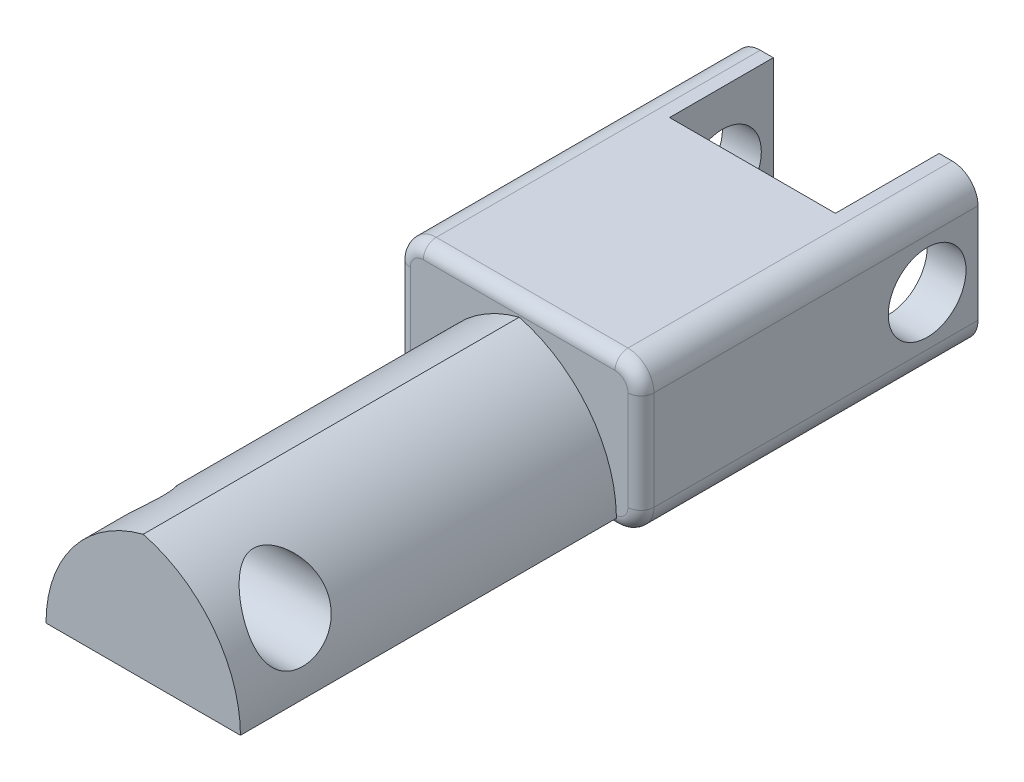
from build123d import *

# Parameters (mm, degrees)
SKETCH1_W                = 15
SKETCH1_H                = 10
BOSS_EXTRUDE1_DEPTH      = 40
BOSS_EXTRUDE2_DEPTH      = 15
BOSS_EXTRUDE2_DEPTH_BACK = 11
SKETCH3_W                = 18.791763322
SKETCH3_H                = 11.646727992
SKETCH4_W                = 12.791763322
SKETCH4_H                = 8
CUT_EXTRUDE1_DEPTH       = 43.707480201
SKETCH5_R                = 3
CUT_EXTRUDE2_DEPTH       = 44.810756502
CUT_EXTRUDE3_DEPTH       = 49.282441533
CUT_EXTRUDE3_DEPTH_BACK  = 49.282441533
SKETCH6_OUTSIDE_W        = 32.648
SKETCH6_OUTSIDE_H        = 25.502
FILLET1_R                = 10
FILLET2_R                = 1
SKETCH7_R                = 3
CUT_EXTRUDE4_DEPTH       = 45.576248719


with BuildPart() as part:
    # Sketch1 → Boss-Extrude1 (new body)
    with BuildSketch(Plane.XY):
        Rectangle(SKETCH1_W, SKETCH1_H)
    extrude(amount=BOSS_EXTRUDE1_DEPTH)

    # Sketch3 → Boss-Extrude2 (add, two sides: drawn at the far end of the back side and taken through both)
    with BuildSketch(Plane(origin=(0, 0, 0), x_dir=(-1, 0, 0), z_dir=(0, 0, -1)).offset(-BOSS_EXTRUDE2_DEPTH_BACK)):
        Rectangle(SKETCH3_W, SKETCH3_H)
    extrude(amount=BOSS_EXTRUDE2_DEPTH + BOSS_EXTRUDE2_DEPTH_BACK)

    # Sketch4 → Cut-Extrude1 (cut, through all)
    with BuildSketch(Plane(origin=(0, 5.823363996, 0), x_dir=(1, 0, 0), z_dir=(0, 1, 0))):
        with Locations((0, 11)):
            Rectangle(SKETCH4_W, SKETCH4_H)
    extrude(amount=-CUT_EXTRUDE1_DEPTH, mode=Mode.SUBTRACT)

    # Sketch5 → Cut-Extrude2 (cut, through all)
    with BuildSketch(Plane.ZY.offset(7.5)):
        with Locations(Location((35, 0, 0), (0, 0, 270))):
            Circle(SKETCH5_R)
    extrude(amount=-CUT_EXTRUDE2_DEPTH, mode=Mode.SUBTRACT)

    # Sketch6 outside → Cut-Extrude3 (cut, two sides: drawn at the far end of the back side and taken through both)
    with BuildSketch(Plane(origin=(0, 0, -7), x_dir=(-1, 0, 0), z_dir=(0, 0, -1)).offset(-CUT_EXTRUDE3_DEPTH_BACK)):
        Rectangle(SKETCH6_OUTSIDE_W, SKETCH6_OUTSIDE_H)
        with BuildLine():
            Line((-7.395881661, 5.823363996), (7.395881661, 5.823363996))
            ThreePointArc((7.395881661, 5.823363996), (8.810095223, 5.237577558), (9.395881661, 3.823363996))
            Line((9.395881661, 3.823363996), (9.395881661, -3.823363996))
            ThreePointArc((9.395881661, -3.823363996), (8.810095223, -5.237577558), (7.395881661, -5.823363996))
            Line((7.395881661, -5.823363996), (-7.395881661, -5.823363996))
            ThreePointArc((-7.395881661, -5.823363996), (-8.810095223, -5.237577558), (-9.395881661, -3.823363996))
            Line((-9.395881661, -3.823363996), (-9.395881661, 3.823363996))
            ThreePointArc((-9.395881661, 3.823363996), (-8.810095223, 5.237577558), (-7.395881661, 5.823363996))
        make_face(mode=Mode.SUBTRACT)
    extrude(amount=CUT_EXTRUDE3_DEPTH + CUT_EXTRUDE3_DEPTH_BACK, mode=Mode.SUBTRACT)

    # Fillet1
    # the kernel refuses this fillet: 10 mm, written as the material it takes off along each edge
    with BuildSketch(Plane(origin=(-7.5, 5, 11), x_dir=(1, 0, 0), z_dir=(0, 0, 1))) as fillet1_piece_1:
        with BuildLine():
            CenterArc((FILLET1_R, -FILLET1_R), FILLET1_R, 90, 90)
            Line((0, -FILLET1_R), (0, 0))
            Line((0, 0), (FILLET1_R, 0))
        make_face()
    extrude(amount=54, mode=Mode.SUBTRACT)
    with BuildSketch(Plane(origin=(7.5, 5, 11), x_dir=(-1, 0, 0), z_dir=(0, 0, 1))) as fillet1_piece_2:
        with BuildLine():
            CenterArc((FILLET1_R, FILLET1_R), FILLET1_R, 180, 90)
            Line((0, FILLET1_R), (0, 0))
            Line((0, 0), (FILLET1_R, 0))
        make_face()
    extrude(amount=54, mode=Mode.SUBTRACT)

    # Fillet2
    # the kernel refuses this fillet: 1 mm, written as the material it takes off along each edge
    with BuildSketch(Plane(origin=(-7.395881661, 3.823363996, 11), x_dir=(0, 1, 0), z_dir=(1, 0, 0))) as fillet2_piece_1:
        with BuildLine():
            CenterArc((2 - FILLET2_R, -FILLET2_R), FILLET2_R, 0, 90)
            Line((2, -FILLET2_R), (2, 0))
            Line((2, 0), (2 - FILLET2_R, 0))
        make_face()
    revolve(axis=Axis((-7.395881661, 3.823363996, 11), (0, 0, 1)), revolution_arc=90, mode=Mode.SUBTRACT)
    with BuildSketch(Plane(origin=(-9.395881661, 3.823363996, 11), x_dir=(1, 0, 0), z_dir=(0, -1, 0)), Plane(origin=(9.395881661, -3.823363996, 11), x_dir=(-1, 0, 0), z_dir=(0, 1, 0))) as fillet2_piece_2:
        with BuildLine():
            CenterArc((FILLET2_R, -FILLET2_R), FILLET2_R, 90, 90)
            Line((0, -FILLET2_R), (0, 0))
            Line((0, 0), (FILLET2_R, 0))
        make_face()
    extrude(amount=7.646727992, mode=Mode.SUBTRACT)
    with BuildSketch(Plane(origin=(-7.395881661, -3.823363996, 11), x_dir=(-1, 0, 0), z_dir=(0, 1, 0))) as fillet2_piece_3_section:
        with BuildLine():
            CenterArc((2 - FILLET2_R, -FILLET2_R), FILLET2_R, 0, 90)
            Line((2, -FILLET2_R), (2, 0))
            Line((2, 0), (2 - FILLET2_R, 0))
        make_face()
    fillet2_piece_3 = revolve(axis=Axis((-7.395881661, -3.823363996, 11), (0, 0, 1)), revolution_arc=90, mode=Mode.PRIVATE)
    fillet2_piece_3 = fillet2_piece_3 - Plane(origin=(2.5, -5, 10.778934244), x_dir=(1, 0, 0), z_dir=(0, 0, -1)) * Cylinder(10, 8, mode=Mode.PRIVATE)
    fillet2_piece_3 = split(fillet2_piece_3, bisect_by=Plane(origin=(-8.996433691, -5, 10.778934244), z_dir=(0, 1, 0)), keep=Keep.TOP, mode=Mode.PRIVATE)
    add(fillet2_piece_3, mode=Mode.SUBTRACT)
    with BuildSketch(Plane(origin=(-7.395881661, -3.823363996, 11), x_dir=(-1, 0, 0), z_dir=(0, 1, 0))) as fillet2_piece_4_section:
        with BuildLine():
            CenterArc((2 - FILLET2_R, -FILLET2_R), FILLET2_R, 0, 90)
            Line((2, -FILLET2_R), (2, 0))
            Line((2, 0), (2 - FILLET2_R, 0))
        make_face()
    fillet2_piece_4 = revolve(axis=Axis((-7.395881661, -3.823363996, 11), (0, 0, 1)), revolution_arc=90, mode=Mode.PRIVATE)
    fillet2_piece_4 = fillet2_piece_4 - Plane(origin=(2.5, -5, 10.736771206), x_dir=(1, 0, 0), z_dir=(0, 0, -1)) * Cylinder(10, 8, mode=Mode.PRIVATE)
    fillet2_piece_4 = split(fillet2_piece_4, bisect_by=Plane(origin=(-8.184472941, -5, 10.736771206), z_dir=(0, -1, 0)), keep=Keep.TOP, mode=Mode.PRIVATE)
    add(fillet2_piece_4, mode=Mode.SUBTRACT)
    with BuildSketch(Plane(origin=(-7.395881661, -3.823363996, 11), x_dir=(-1, 0, 0), z_dir=(0, 1, 0))) as fillet2_piece_5_section:
        with BuildLine():
            CenterArc((2 - FILLET2_R, -FILLET2_R), FILLET2_R, 0, 90)
            Line((2, -FILLET2_R), (2, 0))
            Line((2, 0), (2 - FILLET2_R, 0))
        make_face()
    fillet2_piece_5 = revolve(axis=Axis((-7.395881661, -3.823363996, 11), (0, 0, 1)), revolution_arc=90, mode=Mode.PRIVATE)
    fillet2_piece_5 = fillet2_piece_5 & Plane(origin=(2.5, -5, 10.786120947), x_dir=(1, 0, 0), z_dir=(0, 0, -1)) * Cylinder(10, 8, mode=Mode.PRIVATE)
    fillet2_piece_5 = split(fillet2_piece_5, bisect_by=Plane(origin=(-7.438386145, -5, 10.786120947), z_dir=(0, -1, 0)), keep=Keep.TOP, mode=Mode.PRIVATE)
    add(fillet2_piece_5, mode=Mode.SUBTRACT)
    with BuildSketch(Plane(origin=(7.395881661, -3.823363996, 11), x_dir=(0, -1, 0), z_dir=(-1, 0, 0))) as fillet2_piece_6_section:
        with BuildLine():
            CenterArc((2 - FILLET2_R, -FILLET2_R), FILLET2_R, 0, 90)
            Line((2, -FILLET2_R), (2, 0))
            Line((2, 0), (2 - FILLET2_R, 0))
        make_face()
    fillet2_piece_6 = revolve(axis=Axis((7.395881661, -3.823363996, 11), (0, 0, 1)), revolution_arc=90, mode=Mode.PRIVATE)
    fillet2_piece_6 = fillet2_piece_6 & Plane(origin=(-2.5, -5, 10.786120921), x_dir=(-1, 0, 0), z_dir=(0, 0, -1)) * Cylinder(10, 8, mode=Mode.PRIVATE)
    fillet2_piece_6 = split(fillet2_piece_6, bisect_by=Plane(origin=(7.438386148, -5, 10.786120921), z_dir=(0, -1, 0)), keep=Keep.TOP, mode=Mode.PRIVATE)
    add(fillet2_piece_6, mode=Mode.SUBTRACT)
    with BuildSketch(Plane(origin=(7.395881661, -3.823363996, 11), x_dir=(0, -1, 0), z_dir=(-1, 0, 0))) as fillet2_piece_7_section:
        with BuildLine():
            CenterArc((2 - FILLET2_R, -FILLET2_R), FILLET2_R, 0, 90)
            Line((2, -FILLET2_R), (2, 0))
            Line((2, 0), (2 - FILLET2_R, 0))
        make_face()
    fillet2_piece_7 = revolve(axis=Axis((7.395881661, -3.823363996, 11), (0, 0, 1)), revolution_arc=90, mode=Mode.PRIVATE)
    fillet2_piece_7 = fillet2_piece_7 - Plane(origin=(-2.5, -5, 10.778934427), x_dir=(-1, 0, 0), z_dir=(0, 0, -1)) * Cylinder(10, 8, mode=Mode.PRIVATE)
    fillet2_piece_7 = split(fillet2_piece_7, bisect_by=Plane(origin=(8.996433978, -5, 10.778934427), z_dir=(0, 1, 0)), keep=Keep.TOP, mode=Mode.PRIVATE)
    add(fillet2_piece_7, mode=Mode.SUBTRACT)
    with BuildSketch(Plane(origin=(7.395881661, -3.823363996, 11), x_dir=(0, -1, 0), z_dir=(-1, 0, 0))) as fillet2_piece_8_section:
        with BuildLine():
            CenterArc((2 - FILLET2_R, -FILLET2_R), FILLET2_R, 0, 90)
            Line((2, -FILLET2_R), (2, 0))
            Line((2, 0), (2 - FILLET2_R, 0))
        make_face()
    fillet2_piece_8 = revolve(axis=Axis((7.395881661, -3.823363996, 11), (0, 0, 1)), revolution_arc=90, mode=Mode.PRIVATE)
    fillet2_piece_8 = fillet2_piece_8 - Plane(origin=(-2.5, -5, 10.736771126), x_dir=(-1, 0, 0), z_dir=(0, 0, -1)) * Cylinder(10, 8, mode=Mode.PRIVATE)
    fillet2_piece_8 = split(fillet2_piece_8, bisect_by=Plane(origin=(8.184472929, -5, 10.736771126), z_dir=(0, -1, 0)), keep=Keep.TOP, mode=Mode.PRIVATE)
    add(fillet2_piece_8, mode=Mode.SUBTRACT)
    with BuildSketch(Plane(origin=(7.395881661, 3.823363996, 11), x_dir=(1, 0, 0), z_dir=(0, -1, 0))) as fillet2_piece_9:
        with BuildLine():
            CenterArc((2 - FILLET2_R, -FILLET2_R), FILLET2_R, 0, 90)
            Line((2, -FILLET2_R), (2, 0))
            Line((2, 0), (2 - FILLET2_R, 0))
        make_face()
    revolve(axis=Axis((7.395881661, 3.823363996, 11), (0, 0, 1)), revolution_arc=90, mode=Mode.SUBTRACT)
    with BuildSketch(Plane(origin=(7.395881661, 5.823363996, 11), x_dir=(0, -1, 0), z_dir=(-1, 0, 0))) as fillet2_piece_10:
        with BuildLine():
            CenterArc((FILLET2_R, -FILLET2_R), FILLET2_R, 90, 90)
            Line((0, -FILLET2_R), (0, 0))
            Line((0, 0), (FILLET2_R, 0))
        make_face()
    extrude(amount=14.791763321, mode=Mode.SUBTRACT)
    with BuildSketch(Plane(origin=(-7.395881661, -5.823363996, 11), x_dir=(0, 1, 0), z_dir=(1, 0, 0))) as fillet2_piece_11_section:
        with BuildLine():
            CenterArc((FILLET2_R, -FILLET2_R), FILLET2_R, 90, 90)
            Line((0, -FILLET2_R), (0, 0))
            Line((0, 0), (FILLET2_R, 0))
        make_face()
    fillet2_piece_11 = extrude(amount=14.791763321, mode=Mode.PRIVATE)
    fillet2_piece_11 = split(fillet2_piece_11, bisect_by=Plane(origin=(0, -5, 10.769455145), z_dir=(0, -1, 0)), keep=Keep.TOP, mode=Mode.PRIVATE)
    add(fillet2_piece_11, mode=Mode.SUBTRACT)

    # Sketch7 → Cut-Extrude4 (cut, through all)
    with BuildSketch(Plane(origin=(9.395881661, 0, 0), x_dir=(0, 0, -1), z_dir=(1, 0, 0))):
        with Locations((11.076683863, 0)):
            Circle(SKETCH7_R)
    extrude(amount=-CUT_EXTRUDE4_DEPTH, mode=Mode.SUBTRACT)


solid = part.part
